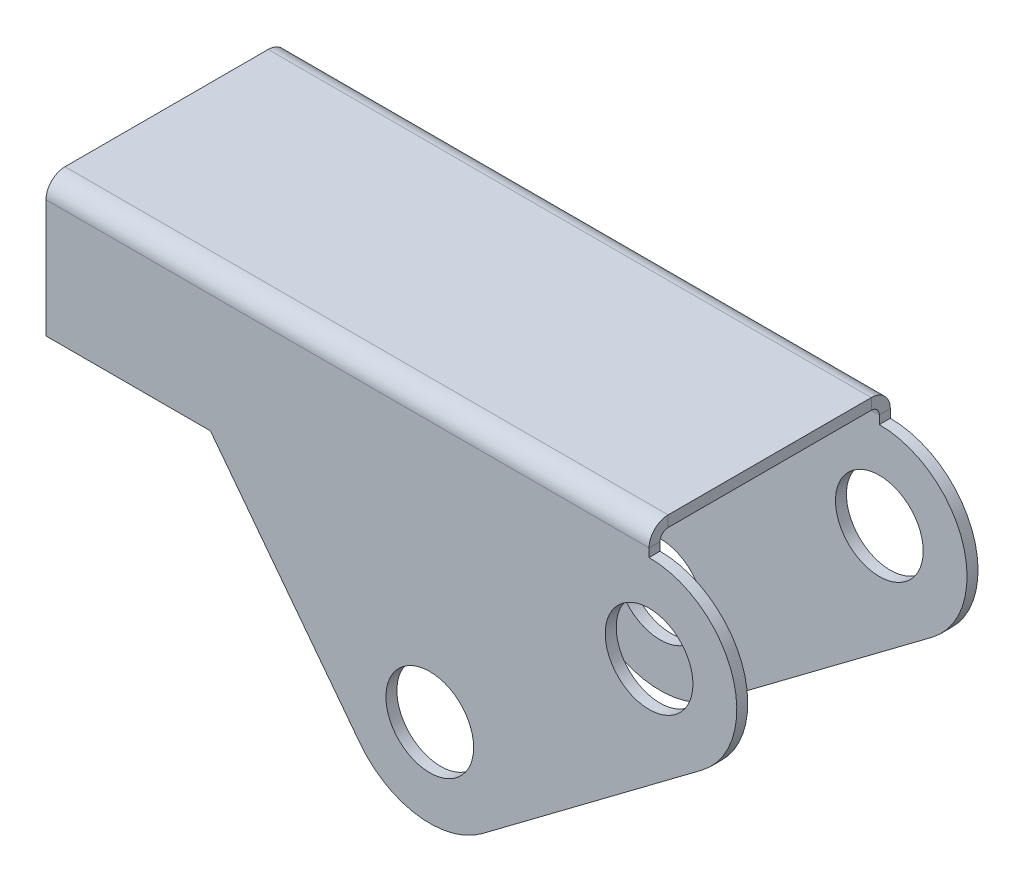
from build123d import *

# Parameters (mm, degrees)
SKETCH_1_R                       = 4
SM_BASE_FLANGE_2_DEPTH           = 1
SM_EDGE_FLANGE_2_STRIP_W         = 5.4732
SM_EDGE_FLANGE_2_STRIP_H         = 1
SM_EDGE_FLANGE_2_STRIP_CUT_DEPTH = 55
SM_EDGE_FLANGE_2_DEPTH           = 55


# Sheet-metal steps are written as plain solids
with BuildPart() as part:
    # Sketch 1 → Базовая кромка2 (new body)
    with BuildSketch(Plane.XY):
        with BuildLine():
            Line((-20, 13), (-6.356958393, -4.856859066))
            ThreePointArc((-6.356958393, -4.856859066), (-1.096061515, -7.924559871), (4.8, -6.4))
            Line((4.8, -6.4), (24.8, 8.6))
            ThreePointArc((24.8, 8.6), (27.589466384, 17.529822128), (20, 23))
            Line((20, 23), (20, 25.5))
            Line((20, 25.5), (-20, 25.5))
            Line((-20, 25.5), (-35, 25.5))
            Line((-35, 25.5), (-35, 13))
            Line((-35, 13), (-20, 13))
        make_face()
        Circle(SKETCH_1_R, mode=Mode.SUBTRACT)
        with Locations((20, 15)):
            Circle(SKETCH_1_R, mode=Mode.SUBTRACT)
    extrude(amount=-SM_BASE_FLANGE_2_DEPTH)

    # Ребро-кромка2 strip (across the edge) → Ребро-кромка2 strip cut (cut)
    with BuildSketch(Plane(origin=(-35, 25.5, -1), x_dir=(0, -1, 0), z_dir=(1, 0, 0))):
        with Locations((-1, -0.5)):
            Rectangle(SM_EDGE_FLANGE_2_STRIP_W, SM_EDGE_FLANGE_2_STRIP_H)
    extrude(amount=SM_EDGE_FLANGE_2_STRIP_CUT_DEPTH, mode=Mode.SUBTRACT)

    # Ребро-кромка2 section (across the edge) → Ребро-кромка2 (add)
    with BuildSketch(Plane(origin=(-35, 25.5, -1), x_dir=(0, -1, 0), z_dir=(1, 0, 0))):
        with BuildLine():
            Line((0, 0.7366), (0, 10))
            Line((0, 10), (1, 10))
            Line((1, 10), (1, 0.7366))
            ThreePointArc((1, 0.7366), (1.215745145, 0.215745145), (1.7366, 0))
            Line((1.7366, 0), (1.7366, -1))
            ThreePointArc((1.7366, -1), (0.508638364, -0.491361636), (0, 0.7366))
        make_face()
    extrude(amount=SM_EDGE_FLANGE_2_DEPTH)

    # Зеркальное отражение1: part across face


with BuildPart() as part_1:
    add(part.part)
    add(part.part.mirror(Plane(origin=(-7.5, 25, -11), x_dir=(1, 0, 0), z_dir=(0, 0, -1))))


solid = part_1.part
